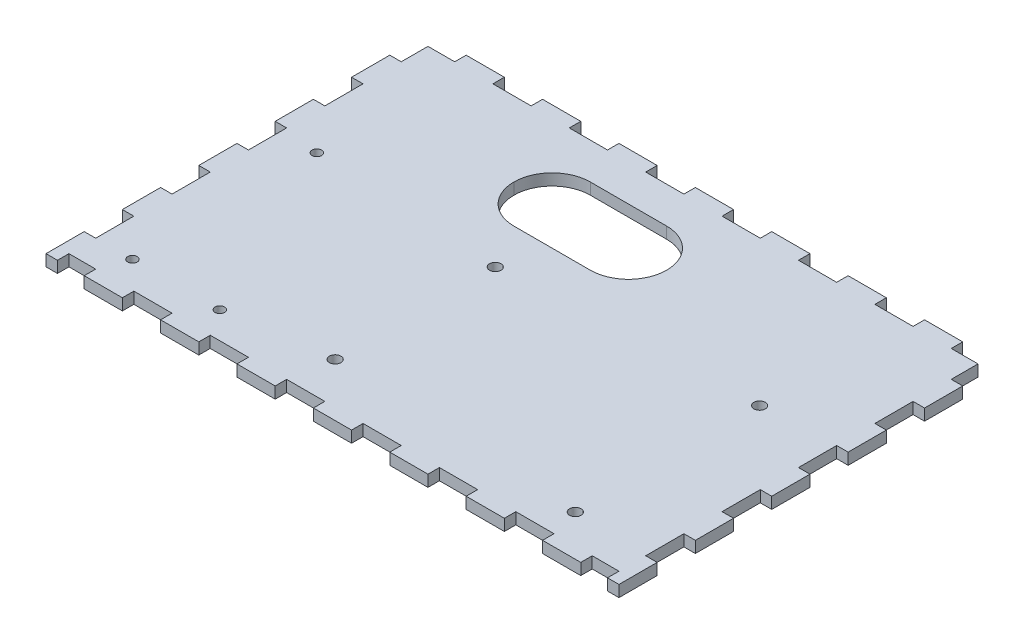
from build123d import *

# Parameters (mm, degrees)
SKETCH1_W               = 150
SKETCH1_H               = 100
BOSS_EXTRUDE1_DEPTH     = 3
SKETCH2_W               = 10
SKETCH2_H               = 3
CUT_EXTRUDE2_DEPTH      = 91.188691087
LPATTERN1_COUNT         = 8
LPATTERN1_PITCH         = 20
MIRROR1_COPY_1_SKETCH_W = 10
MIRROR1_COPY_1_SKETCH_H = 3
MIRROR1_COPY_1_DEPTH    = 91.188691087
MIRROR1_COPY_2_SKETCH_W = 10
MIRROR1_COPY_2_SKETCH_H = 3
MIRROR1_COPY_2_DEPTH    = 91.188691087
MIRROR1_COPY_3_SKETCH_W = 10
MIRROR1_COPY_3_SKETCH_H = 3
MIRROR1_COPY_3_DEPTH    = 91.188691087
MIRROR1_COPY_4_SKETCH_W = 10
MIRROR1_COPY_4_SKETCH_H = 3
MIRROR1_COPY_4_DEPTH    = 91.188691087
MIRROR1_COPY_5_SKETCH_W = 10
MIRROR1_COPY_5_SKETCH_H = 3
MIRROR1_COPY_5_DEPTH    = 91.188691087
MIRROR1_COPY_6_SKETCH_W = 10
MIRROR1_COPY_6_SKETCH_H = 3
MIRROR1_COPY_6_DEPTH    = 91.188691087
MIRROR1_COPY_7_SKETCH_W = 10
MIRROR1_COPY_7_SKETCH_H = 3
MIRROR1_COPY_7_DEPTH    = 91.188691087
SKETCH3_W               = 3
SKETCH3_H               = 10
CUT_EXTRUDE3_DEPTH      = 91.188691087
LPATTERN2_COUNT         = 5
LPATTERN2_PITCH         = 20
MIRROR2_COPY_1_SKETCH_W = 3
MIRROR2_COPY_1_SKETCH_H = 10
MIRROR2_COPY_1_DEPTH    = 91.188691087
MIRROR2_COPY_2_SKETCH_W = 3
MIRROR2_COPY_2_SKETCH_H = 10
MIRROR2_COPY_2_DEPTH    = 91.188691087
MIRROR2_COPY_3_SKETCH_W = 3
MIRROR2_COPY_3_SKETCH_H = 10
MIRROR2_COPY_3_DEPTH    = 91.188691087
MIRROR2_COPY_4_SKETCH_W = 3
MIRROR2_COPY_4_SKETCH_H = 10
MIRROR2_COPY_4_DEPTH    = 91.188691087
SKETCH4_W               = 40
SKETCH4_H               = 20
CUT_EXTRUDE4_DEPTH      = 91.188691087
FILLET1_R               = 10
SKETCH5_W               = 3
SKETCH5_H               = 3
BOSS_EXTRUDE2_DEPTH     = 3
SKETCH6_R               = 1.5
SKETCH6_R_2             = 1.25
CUT_EXTRUDE5_DEPTH      = 91.188691087


with BuildPart() as part:
    # Sketch1 → Boss-Extrude1 (new body)
    with BuildSketch(Plane(origin=(0, 0, 0), x_dir=(1, 0, 0), z_dir=(0, 1, 0))):
        Rectangle(SKETCH1_W, SKETCH1_H)
    extrude(amount=BOSS_EXTRUDE1_DEPTH)

    # Sketch2 → Cut-Extrude2 (cut, through all)
    with BuildSketch(Plane(origin=(0, 3, 0), x_dir=(1, 0, 0), z_dir=(0, 1, 0))):
        with Locations((-70, -48.5)):
            Rectangle(SKETCH2_W, SKETCH2_H)
    cut_extrude2 = extrude(amount=-CUT_EXTRUDE2_DEPTH, mode=Mode.SUBTRACT)

    # LPattern1: Cut-Extrude2 ×8
    with Locations(*[(i * LPATTERN1_PITCH, 0, 0) for i in range(1, LPATTERN1_COUNT)]):
        add(cut_extrude2, mode=Mode.SUBTRACT)

    # Mirror1: Cut-Extrude2 across plane
    add(cut_extrude2.mirror(Plane.XY), mode=Mode.SUBTRACT)

    # Mirror1 copy 1 sketch → Mirror1 copy 1 (cut, through all)
    with BuildSketch(Plane(origin=(20, 3, 0), x_dir=(1, 0, 0), z_dir=(0, 1, 0))):
        with Locations((-70, 48.5)):
            Rectangle(MIRROR1_COPY_1_SKETCH_W, MIRROR1_COPY_1_SKETCH_H)
    extrude(amount=-MIRROR1_COPY_1_DEPTH, mode=Mode.SUBTRACT)

    # Mirror1 copy 2 sketch → Mirror1 copy 2 (cut, through all)
    with BuildSketch(Plane(origin=(40, 3, 0), x_dir=(1, 0, 0), z_dir=(0, 1, 0))):
        with Locations((-70, 48.5)):
            Rectangle(MIRROR1_COPY_2_SKETCH_W, MIRROR1_COPY_2_SKETCH_H)
    extrude(amount=-MIRROR1_COPY_2_DEPTH, mode=Mode.SUBTRACT)

    # Mirror1 copy 3 sketch → Mirror1 copy 3 (cut, through all)
    with BuildSketch(Plane(origin=(60, 3, 0), x_dir=(1, 0, 0), z_dir=(0, 1, 0))):
        with Locations((-70, 48.5)):
            Rectangle(MIRROR1_COPY_3_SKETCH_W, MIRROR1_COPY_3_SKETCH_H)
    extrude(amount=-MIRROR1_COPY_3_DEPTH, mode=Mode.SUBTRACT)

    # Mirror1 copy 4 sketch → Mirror1 copy 4 (cut, through all)
    with BuildSketch(Plane(origin=(80, 3, 0), x_dir=(1, 0, 0), z_dir=(0, 1, 0))):
        with Locations((-70, 48.5)):
            Rectangle(MIRROR1_COPY_4_SKETCH_W, MIRROR1_COPY_4_SKETCH_H)
    extrude(amount=-MIRROR1_COPY_4_DEPTH, mode=Mode.SUBTRACT)

    # Mirror1 copy 5 sketch → Mirror1 copy 5 (cut, through all)
    with BuildSketch(Plane(origin=(100, 3, 0), x_dir=(1, 0, 0), z_dir=(0, 1, 0))):
        with Locations((-70, 48.5)):
            Rectangle(MIRROR1_COPY_5_SKETCH_W, MIRROR1_COPY_5_SKETCH_H)
    extrude(amount=-MIRROR1_COPY_5_DEPTH, mode=Mode.SUBTRACT)

    # Mirror1 copy 6 sketch → Mirror1 copy 6 (cut, through all)
    with BuildSketch(Plane(origin=(120, 3, 0), x_dir=(1, 0, 0), z_dir=(0, 1, 0))):
        with Locations((-70, 48.5)):
            Rectangle(MIRROR1_COPY_6_SKETCH_W, MIRROR1_COPY_6_SKETCH_H)
    extrude(amount=-MIRROR1_COPY_6_DEPTH, mode=Mode.SUBTRACT)

    # Mirror1 copy 7 sketch → Mirror1 copy 7 (cut, through all)
    with BuildSketch(Plane(origin=(140, 3, 0), x_dir=(1, 0, 0), z_dir=(0, 1, 0))):
        with Locations((-70, 48.5)):
            Rectangle(MIRROR1_COPY_7_SKETCH_W, MIRROR1_COPY_7_SKETCH_H)
    extrude(amount=-MIRROR1_COPY_7_DEPTH, mode=Mode.SUBTRACT)

    # Sketch3 → Cut-Extrude3 (cut, through all)
    with BuildSketch(Plane(origin=(0, 3, 0), x_dir=(1, 0, 0), z_dir=(0, 1, 0))):
        with Locations((-73.5, -35)):
            Rectangle(SKETCH3_W, SKETCH3_H)
    cut_extrude3 = extrude(amount=-CUT_EXTRUDE3_DEPTH, mode=Mode.SUBTRACT)

    # LPattern2: Cut-Extrude3 ×5
    with Locations(*[(0, 0, -i * LPATTERN2_PITCH) for i in range(1, LPATTERN2_COUNT)]):
        add(cut_extrude3, mode=Mode.SUBTRACT)

    # Mirror2: Cut-Extrude3 across plane
    add(cut_extrude3.mirror(Plane(origin=(0, 0, 0), x_dir=(0, 0, 1), z_dir=(1, 0, 0))), mode=Mode.SUBTRACT)

    # Mirror2 copy 1 sketch → Mirror2 copy 1 (cut, through all)
    with BuildSketch(Plane(origin=(0, 3, -20), x_dir=(-1, 0, 0), z_dir=(0, 1, 0))):
        with Locations((-73.5, 35)):
            Rectangle(MIRROR2_COPY_1_SKETCH_W, MIRROR2_COPY_1_SKETCH_H)
    extrude(amount=-MIRROR2_COPY_1_DEPTH, mode=Mode.SUBTRACT)

    # Mirror2 copy 2 sketch → Mirror2 copy 2 (cut, through all)
    with BuildSketch(Plane(origin=(0, 3, -40), x_dir=(-1, 0, 0), z_dir=(0, 1, 0))):
        with Locations((-73.5, 35)):
            Rectangle(MIRROR2_COPY_2_SKETCH_W, MIRROR2_COPY_2_SKETCH_H)
    extrude(amount=-MIRROR2_COPY_2_DEPTH, mode=Mode.SUBTRACT)

    # Mirror2 copy 3 sketch → Mirror2 copy 3 (cut, through all)
    with BuildSketch(Plane(origin=(0, 3, -60), x_dir=(-1, 0, 0), z_dir=(0, 1, 0))):
        with Locations((-73.5, 35)):
            Rectangle(MIRROR2_COPY_3_SKETCH_W, MIRROR2_COPY_3_SKETCH_H)
    extrude(amount=-MIRROR2_COPY_3_DEPTH, mode=Mode.SUBTRACT)

    # Mirror2 copy 4 sketch → Mirror2 copy 4 (cut, through all)
    with BuildSketch(Plane(origin=(0, 3, -80), x_dir=(-1, 0, 0), z_dir=(0, 1, 0))):
        with Locations((-73.5, 35)):
            Rectangle(MIRROR2_COPY_4_SKETCH_W, MIRROR2_COPY_4_SKETCH_H)
    extrude(amount=-MIRROR2_COPY_4_DEPTH, mode=Mode.SUBTRACT)

    # Sketch4 → Cut-Extrude4 (cut, through all)
    with BuildSketch(Plane(origin=(0, 3, 0), x_dir=(1, 0, 0), z_dir=(0, 1, 0))):
        with Locations((-10, 27.5)):
            Rectangle(SKETCH4_W, SKETCH4_H)
    extrude(amount=-CUT_EXTRUDE4_DEPTH, mode=Mode.SUBTRACT)

    # Fillet1
    fillet1_edges = [part.edges().sort_by_distance(p)[0] for p in [
        (10, 1.5, -17.5),
        (10, 1.5, -37.5),
        (-30, 1.5, -37.5),
        (-30, 1.5, -17.5),
    ]]
    fillet(fillet1_edges, radius=FILLET1_R - 0.0001)  # a hair under: the kernel refuses the full size

    # Sketch5 → Boss-Extrude2 (add)
    with BuildSketch(Plane.XY.offset(47)):
        with Locations((73.5, 1.5)):
            Rectangle(SKETCH5_W, SKETCH5_H)
    boss_extrude2 = extrude(amount=BOSS_EXTRUDE2_DEPTH)

    # Mirror3: Boss-Extrude2 across plane
    add(boss_extrude2.mirror(Plane(origin=(0, 0, 0), x_dir=(0, 0, 1), z_dir=(1, 0, 0))))

    # Sketch6 → Cut-Extrude5 (cut, through all)
    with BuildSketch(Plane(origin=(0, 3, 0), x_dir=(1, 0, 0), z_dir=(0, 1, 0))):
        with Locations(Location((-13.16772538, -36.12518928, 0), (0, 0, 270))):
            Circle(SKETCH6_R)
        with Locations(Location((-13.16772538, 5.78481072, 0), (0, 0, 270))):
            Circle(SKETCH6_R)
        with Locations(Location((52.87227462, 8.95981072, 0), (0, 0, 270))):
            Circle(SKETCH6_R)
        with Locations(Location((52.87227462, -39.30018928, 0), (0, 0, 270))):
            Circle(SKETCH6_R)
        with Locations(Location((-39.54, -39.96, 0), (0, 0, 270))):
            Circle(SKETCH6_R_2)
        with Locations(Location((-62.4, -39.96, 0), (0, 0, 270))):
            Circle(SKETCH6_R_2)
        with Locations(Location((-62.4, 8.3, 0), (0, 0, 270))):
            Circle(SKETCH6_R_2)
    extrude(amount=-CUT_EXTRUDE5_DEPTH, mode=Mode.SUBTRACT)


solid = part.part
